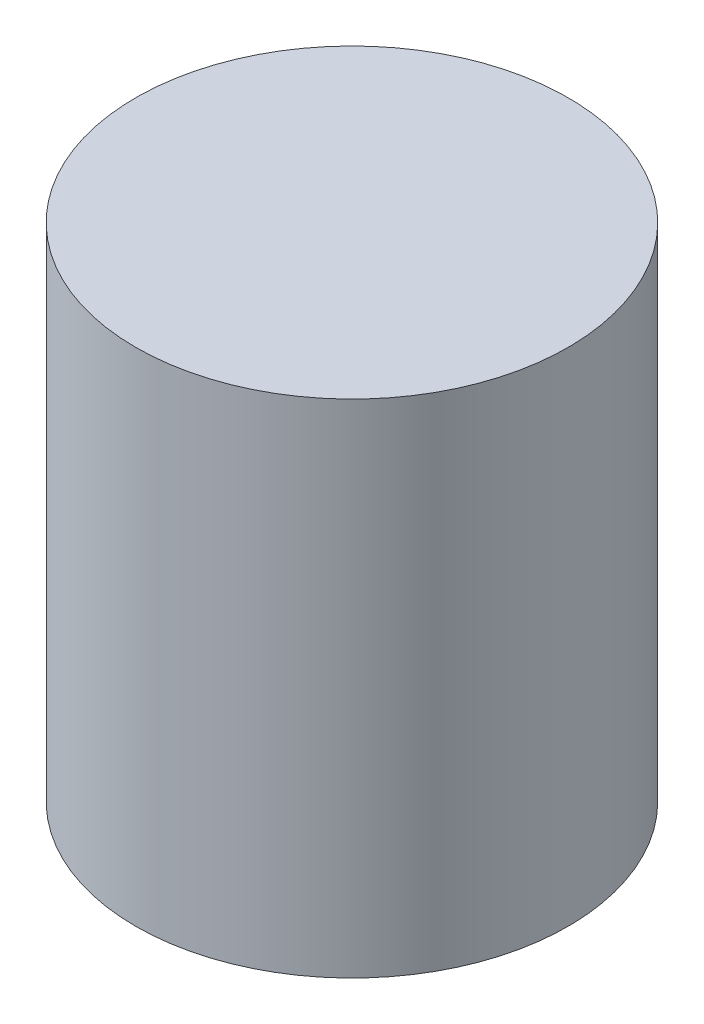
from build123d import *

# Parameters (mm, degrees)
SKETCH1_R           = 6.9
BOSS_EXTRUDE1_DEPTH = 16


with BuildPart() as part:
    # Sketch1 → Boss-Extrude1 (new body)
    with BuildSketch(Plane(origin=(0, 0, 0), x_dir=(1, 0, 0), z_dir=(0, 1, 0))):
        Circle(SKETCH1_R)
    extrude(amount=BOSS_EXTRUDE1_DEPTH)


solid = part.part
